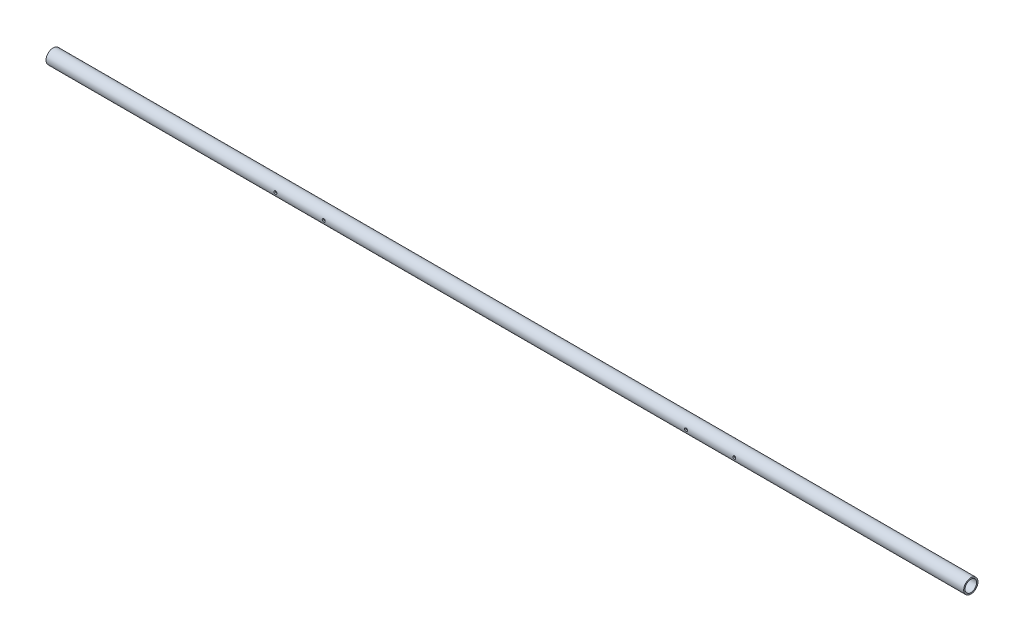
from build123d import *

# Parameters (mm, degrees)
BOSS_EXTRUDE1_DEPTH                 = 241.3
BOSS_EXTRUDE1_DEPTH_BACK            = 241.3
SKETCH1_R                           = 3.7592
SKETCH1_R_2                         = 3.048
CUT_EXTRUDE1_REACH                  = 243.359
CUT_EXTRUDE1_END_RADIUS             = 3.7592
SKETCH2_R                           = 0.777875
CUT_EXTRUDE1_DIRECTION_2_REACH      = 243.359
CUT_EXTRUDE1_DIRECTION_2_END_RADIUS = 3.7592


with BuildPart() as part:
    # Sketch1 → Boss-Extrude1 (new, two sides: drawn at the far end of the back side and taken through both)
    with BuildSketch(Plane(origin=(0, 0, 0), x_dir=(0, 0, -1), z_dir=(1, 0, 0)).offset(-BOSS_EXTRUDE1_DEPTH_BACK)):
        Circle(SKETCH1_R)
        Circle(SKETCH1_R_2, mode=Mode.SUBTRACT)
    extrude(amount=BOSS_EXTRUDE1_DEPTH + BOSS_EXTRUDE1_DEPTH_BACK)

    # Cut-Extrude1: up to this cylinder (the profile starts inside it)
    cut_extrude1_end = Plane(origin=(0, 0, 0), z_dir=(1, 0, 0)) * Cylinder(CUT_EXTRUDE1_END_RADIUS, 736.5364, mode=Mode.PRIVATE)
    # Sketch2 → Cut-Extrude1 (cut, up to the surface)
    with BuildSketch(Plane.XY, mode=Mode.PRIVATE) as cut_extrude1_sk1:
        with Locations((95.25, 0)):
            Circle(SKETCH2_R)
    cut_extrude1_tool1 = extrude(cut_extrude1_sk1.sketch, amount=-CUT_EXTRUDE1_REACH, mode=Mode.PRIVATE) & cut_extrude1_end
    add(cut_extrude1_tool1.solids().sort_by_distance((95.25, 0, 0))[0], mode=Mode.SUBTRACT)
    # Sketch2 → Cut-Extrude1 (cut, up to the surface)
    with BuildSketch(Plane.XY, mode=Mode.PRIVATE) as cut_extrude1_sk2:
        with Locations((120.65, 0)):
            Circle(SKETCH2_R)
    cut_extrude1_tool2 = extrude(cut_extrude1_sk2.sketch, amount=-CUT_EXTRUDE1_REACH, mode=Mode.PRIVATE) & cut_extrude1_end
    add(cut_extrude1_tool2.solids().sort_by_distance((120.65, 0, 0))[0], mode=Mode.SUBTRACT)
    # Sketch2 → Cut-Extrude1 (cut, up to the surface)
    with BuildSketch(Plane.XY, mode=Mode.PRIVATE) as cut_extrude1_sk3:
        with Locations((-120.65, 0)):
            Circle(SKETCH2_R)
    cut_extrude1_tool3 = extrude(cut_extrude1_sk3.sketch, amount=-CUT_EXTRUDE1_REACH, mode=Mode.PRIVATE) & cut_extrude1_end
    add(cut_extrude1_tool3.solids().sort_by_distance((-120.65, 0, 0))[0], mode=Mode.SUBTRACT)
    # Sketch2 → Cut-Extrude1 (cut, up to the surface)
    with BuildSketch(Plane.XY, mode=Mode.PRIVATE) as cut_extrude1_sk4:
        with Locations((-95.25, 0)):
            Circle(SKETCH2_R)
    cut_extrude1_tool4 = extrude(cut_extrude1_sk4.sketch, amount=-CUT_EXTRUDE1_REACH, mode=Mode.PRIVATE) & cut_extrude1_end
    add(cut_extrude1_tool4.solids().sort_by_distance((-95.25, 0, 0))[0], mode=Mode.SUBTRACT)

    # Cut-Extrude1 direction 2: up to this cylinder (the profile starts inside it)
    cut_extrude1_direction_2_end = Plane(origin=(0, 0, 0), z_dir=(1, 0, 0)) * Cylinder(CUT_EXTRUDE1_DIRECTION_2_END_RADIUS, 736.5364, mode=Mode.PRIVATE)
    # Sketch2 → Cut-Extrude1 direction 2 (cut, up to the surface)
    with BuildSketch(Plane.XY, mode=Mode.PRIVATE) as cut_extrude1_direction_2_sk1:
        with Locations((95.25, 0)):
            Circle(SKETCH2_R)
    cut_extrude1_direction_2_tool1 = extrude(cut_extrude1_direction_2_sk1.sketch, amount=CUT_EXTRUDE1_DIRECTION_2_REACH, mode=Mode.PRIVATE) & cut_extrude1_direction_2_end
    add(cut_extrude1_direction_2_tool1.solids().sort_by_distance((95.25, 0, 0))[0], mode=Mode.SUBTRACT)
    # Sketch2 → Cut-Extrude1 direction 2 (cut, up to the surface)
    with BuildSketch(Plane.XY, mode=Mode.PRIVATE) as cut_extrude1_direction_2_sk2:
        with Locations((120.65, 0)):
            Circle(SKETCH2_R)
    cut_extrude1_direction_2_tool2 = extrude(cut_extrude1_direction_2_sk2.sketch, amount=CUT_EXTRUDE1_DIRECTION_2_REACH, mode=Mode.PRIVATE) & cut_extrude1_direction_2_end
    add(cut_extrude1_direction_2_tool2.solids().sort_by_distance((120.65, 0, 0))[0], mode=Mode.SUBTRACT)
    # Sketch2 → Cut-Extrude1 direction 2 (cut, up to the surface)
    with BuildSketch(Plane.XY, mode=Mode.PRIVATE) as cut_extrude1_direction_2_sk3:
        with Locations((-120.65, 0)):
            Circle(SKETCH2_R)
    cut_extrude1_direction_2_tool3 = extrude(cut_extrude1_direction_2_sk3.sketch, amount=CUT_EXTRUDE1_DIRECTION_2_REACH, mode=Mode.PRIVATE) & cut_extrude1_direction_2_end
    add(cut_extrude1_direction_2_tool3.solids().sort_by_distance((-120.65, 0, 0))[0], mode=Mode.SUBTRACT)
    # Sketch2 → Cut-Extrude1 direction 2 (cut, up to the surface)
    with BuildSketch(Plane.XY, mode=Mode.PRIVATE) as cut_extrude1_direction_2_sk4:
        with Locations((-95.25, 0)):
            Circle(SKETCH2_R)
    cut_extrude1_direction_2_tool4 = extrude(cut_extrude1_direction_2_sk4.sketch, amount=CUT_EXTRUDE1_DIRECTION_2_REACH, mode=Mode.PRIVATE) & cut_extrude1_direction_2_end
    add(cut_extrude1_direction_2_tool4.solids().sort_by_distance((-95.25, 0, 0))[0], mode=Mode.SUBTRACT)


solid = part.part
